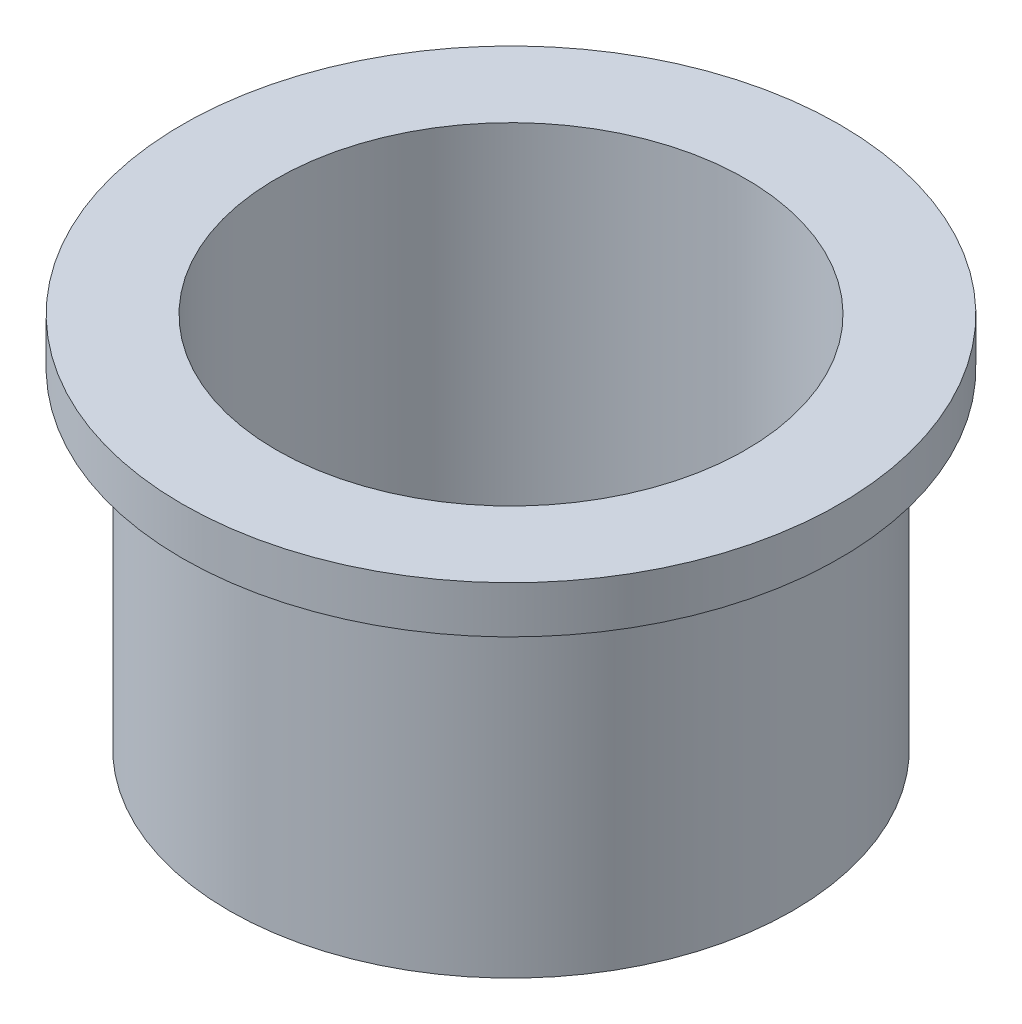
from build123d import *

# Parameters (mm, degrees)
SKETCH1_R           = 15
SKETCH1_R_2         = 12.5
BOSS_EXTRUDE1_DEPTH = 20
BOSS_EXTRUDE2_START = -2.5
SKETCH2_R           = 17.5
SKETCH2_R_2         = 15
BOSS_EXTRUDE2_DEPTH = 2.5


with BuildPart() as part:
    # Sketch1 → Boss-Extrude1 (new body)
    with BuildSketch(Plane(origin=(0, 0, 0), x_dir=(1, 0, 0), z_dir=(0, 1, 0))):
        Circle(SKETCH1_R)
        Circle(SKETCH1_R_2, mode=Mode.SUBTRACT)
    extrude(amount=BOSS_EXTRUDE1_DEPTH)

    # Sketch2 → Boss-Extrude2 (add)
    with BuildSketch(Plane(origin=(0, 20, 0), x_dir=(1, 0, 0), z_dir=(0, 1, 0)).offset(BOSS_EXTRUDE2_START)):
        Circle(SKETCH2_R)
        Circle(SKETCH2_R_2, mode=Mode.SUBTRACT)
    extrude(amount=BOSS_EXTRUDE2_DEPTH)


solid = part.part
